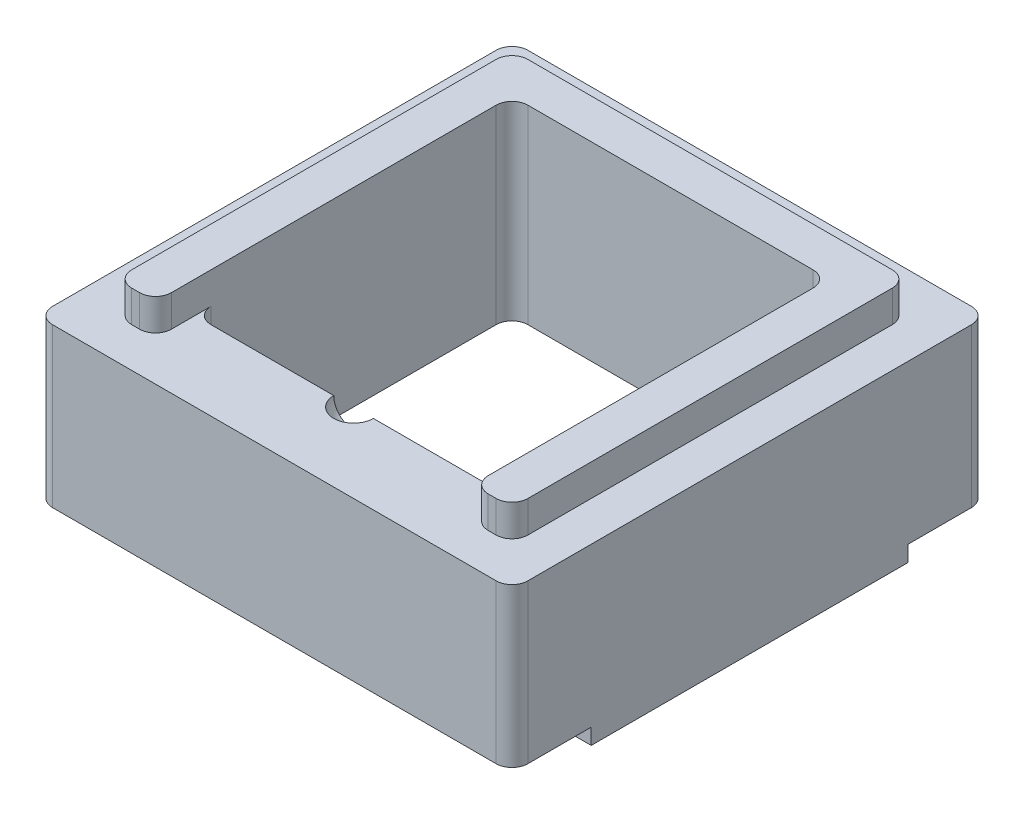
from build123d import *

# Parameters (mm, degrees)
BOSS_EXTRUDE1_DEPTH = 2
SKETCH3_W           = 30
SKETCH3_H           = 30
SKETCH3_W_2         = 20
SKETCH3_H_2         = 20
BOSS_EXTRUDE2_DEPTH = 10
SKETCH4_W           = 1.5
SKETCH4_H           = 20
BOSS_EXTRUDE3_DEPTH = 1
FILLET2_R           = 1


with BuildPart() as part:
    # Sketch1 → Boss-Extrude1 (new body)
    with BuildSketch(Plane(origin=(0, 0, 0), x_dir=(1, 0, 0), z_dir=(0, 1, 0))):
        Polygon((-12.5, 12.5), (-12.5, -12.5), (-10, -12.5), (-10, 10), (10, 10), (10, -12.5), (12.5, -12.5), (12.5, 12.5), align=None)
    extrude(amount=BOSS_EXTRUDE1_DEPTH)

    # Sketch3 → Boss-Extrude2 (add)
    with BuildSketch(Plane.XZ):
        Rectangle(SKETCH3_W, SKETCH3_H)
        Rectangle(SKETCH3_W_2, SKETCH3_H_2, mode=Mode.SUBTRACT)
    extrude(amount=BOSS_EXTRUDE2_DEPTH)

    # Sketch4 → Boss-Extrude3 (add)
    with BuildSketch(Plane.XZ.offset(10)):
        with Locations((-14.25, 0)):
            Rectangle(SKETCH4_W, SKETCH4_H)
        with Locations((14.25, 0)):
            Rectangle(SKETCH4_W, SKETCH4_H)
    extrude(amount=BOSS_EXTRUDE3_DEPTH)

    # Sketch5 → Cut-Revolve4 (revolve, cut)
    with BuildSketch(Plane(origin=(0, 0, 0), x_dir=(0, 0, -1), z_dir=(1, 0, 0))):
        with BuildLine():
            Line((-8.75, 0), (-11.25, 0))
            ThreePointArc((-11.25, 0), (-10, -1.25), (-8.75, 0))
        make_face()
    revolve(axis=Axis((0, 0, 1000), (0, 0, -1)), mode=Mode.SUBTRACT)

    # Fillet2
    fillet2_edges = [part.edges().sort_by_distance(p)[0] for p in [
        (-15, -5, 15),
        (15, -5, 15),
        (15, -5, -15),
        (-15, -5, -15),
        (-10, -4, -10),
        (-10, -5, 10),
        (10, -5, 10),
        (10, -4, -10),
        (-10, 1, 12.5),
        (12.5, 1, -12.5),
        (12.5, 1, 12.5),
        (10, 1, 12.5),
        (-12.5, 1, 12.5),
        (-12.5, 1, -12.5),
    ]]
    fillet(fillet2_edges, radius=FILLET2_R)


solid = part.part
